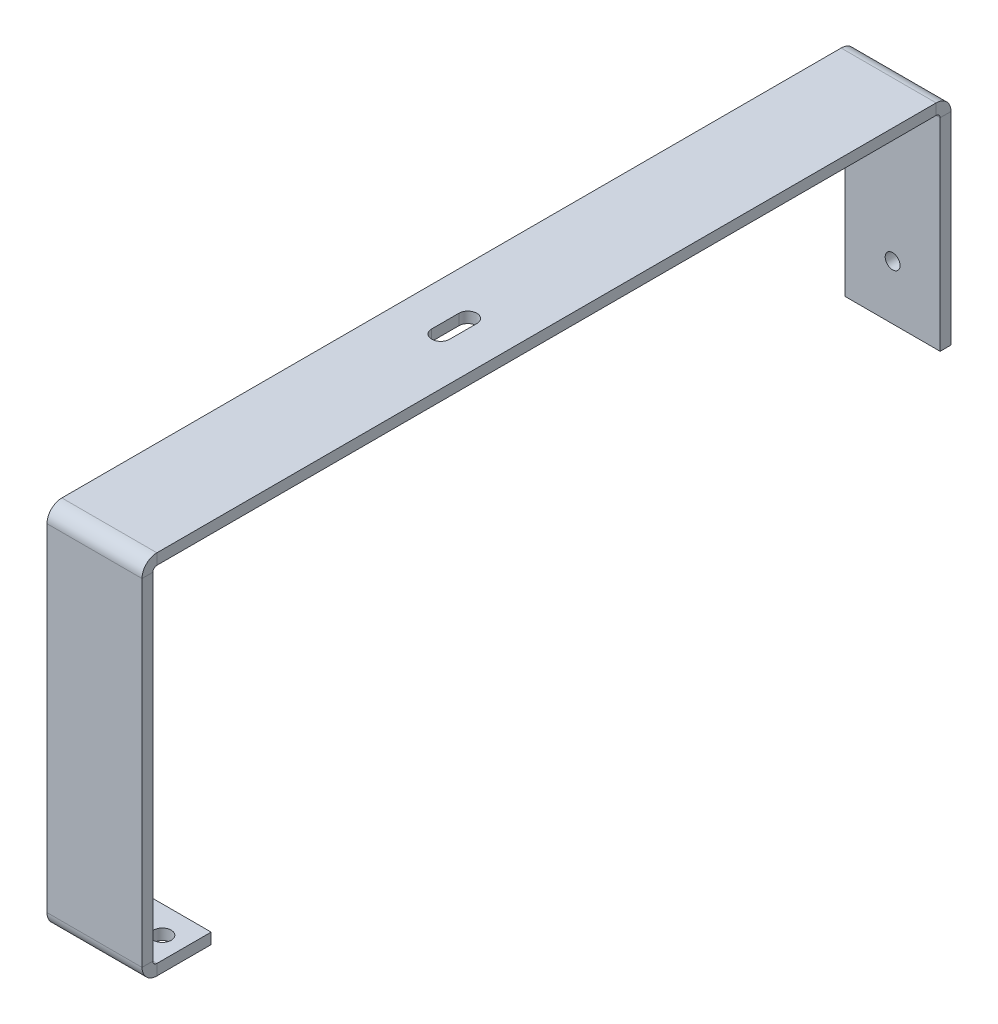
from build123d import *

# Parameters (mm, degrees)
SKETCH1_W                    = 17.5
SKETCH1_H                    = 10
BASE_FLANGE1_DEPTH           = 2
EDGE_FLANGE1_DEPTH           = 17.5
EDGE_FLANGE2_STRIP_W         = 9.4732
EDGE_FLANGE2_STRIP_H         = 2
EDGE_FLANGE2_STRIP_CUT_DEPTH = 17.5
EDGE_FLANGE2_DEPTH           = 17.5
EDGE_FLANGE3_STRIP_W         = 9.4732
EDGE_FLANGE3_STRIP_H         = 2
EDGE_FLANGE3_STRIP_CUT_DEPTH = 17.5
EDGE_FLANGE3_DEPTH           = 17.5
F_4_CLEARANCE_HOLE1_D        = 3.2639
F_4_CLEARANCE_HOLE1_DEPTH    = 2
F_4_CLEARANCE_HOLE1_TIP      = 0.980574487
CUT_EXTRUDE3_DEPTH           = 2
SKETCH25_R                   = 1.373100621
CUT_EXTRUDE4_DEPTH           = 2


# Sheet-metal steps are written as plain solids
with BuildPart() as part:
    # Sketch1 → Base-Flange1 (new body)
    with BuildSketch(Plane(origin=(0, 0, 0), x_dir=(1, 0, 0), z_dir=(0, 1, 0))):
        Rectangle(SKETCH1_W, SKETCH1_H)
    extrude(amount=BASE_FLANGE1_DEPTH)

    # Edge-Flange1 section (across the edge) → Edge-Flange1 (add)
    with BuildSketch(Plane(origin=(-8.75, 2, 5.7366), x_dir=(0, 0, -1), z_dir=(1, 0, 0))):
        with BuildLine():
            Line((-2, 0.7366), (-2, 65.5))
            Line((-2, 65.5), (0, 65.5))
            Line((0, 65.5), (0, 0.7366))
            ThreePointArc((0, 0.7366), (0.215745145, 0.215745145), (0.7366, 0))
            Line((0.7366, 0), (0.7366, -2))
            ThreePointArc((0.7366, -2), (-1.198468417, -1.198468417), (-2, 0.7366))
        make_face()
    extrude(amount=EDGE_FLANGE1_DEPTH)

    # Edge-Flange2 strip (across the edge) → Edge-Flange2 strip cut (cut)
    with BuildSketch(Plane(origin=(-8.75, 67.5, 5.7366), x_dir=(0, -1, 0), z_dir=(1, 0, 0))):
        with Locations((-2, -1)):
            Rectangle(EDGE_FLANGE2_STRIP_W, EDGE_FLANGE2_STRIP_H)
    extrude(amount=EDGE_FLANGE2_STRIP_CUT_DEPTH, mode=Mode.SUBTRACT)

    # Edge-Flange2 section (across the edge) → Edge-Flange2 (add)
    with BuildSketch(Plane(origin=(-8.75, 67.5, 5.7366), x_dir=(0, -1, 0), z_dir=(1, 0, 0))):
        with BuildLine():
            Line((0, 0.7366), (0, 147))
            Line((0, 147), (2, 147))
            Line((2, 147), (2, 0.7366))
            ThreePointArc((2, 0.7366), (2.215745145, 0.215745145), (2.7366, 0))
            Line((2.7366, 0), (2.7366, -2))
            ThreePointArc((2.7366, -2), (0.801531583, -1.198468417), (0, 0.7366))
        make_face()
    extrude(amount=EDGE_FLANGE2_DEPTH)

    # Edge-Flange3 strip (across the edge) → Edge-Flange3 strip cut (cut)
    with BuildSketch(Plane(origin=(-8.75, 65.5, -141.2634), x_dir=(0, 0, 1), z_dir=(1, 0, 0))):
        with Locations((-2, -1)):
            Rectangle(EDGE_FLANGE3_STRIP_W, EDGE_FLANGE3_STRIP_H)
    extrude(amount=EDGE_FLANGE3_STRIP_CUT_DEPTH, mode=Mode.SUBTRACT)

    # Edge-Flange3 section (across the edge) → Edge-Flange3 (add)
    with BuildSketch(Plane(origin=(-8.75, 65.5, -141.2634), x_dir=(0, 0, 1), z_dir=(1, 0, 0))):
        with BuildLine():
            Line((0, 0.7366), (0, 38))
            Line((0, 38), (2, 38))
            Line((2, 38), (2, 0.7366))
            ThreePointArc((2, 0.7366), (2.215745145, 0.215745145), (2.7366, 0))
            Line((2.7366, 0), (2.7366, -2))
            ThreePointArc((2.7366, -2), (0.801531583, -1.198468417), (0, 0.7366))
        make_face()
    extrude(amount=EDGE_FLANGE3_DEPTH)

    # #4 Clearance Hole1
    with Locations(Plane.XZ):
        with Locations((4.75, 0), (-4.75, 0)):
            Hole(F_4_CLEARANCE_HOLE1_D / 2, depth=F_4_CLEARANCE_HOLE1_DEPTH)
            with Locations((0, 0, -(F_4_CLEARANCE_HOLE1_DEPTH + F_4_CLEARANCE_HOLE1_TIP / 2))):  # 118° drill point
                Cone(0, F_4_CLEARANCE_HOLE1_D / 2, F_4_CLEARANCE_HOLE1_TIP, mode=Mode.SUBTRACT)

    # Sketch23 → Cut-Extrude3 (cut)
    with BuildSketch(Plane.XZ.offset(-65.5)):
        with BuildLine():
            Line((-1.65, -61.0268), (-1.65, -56.0268))
            ThreePointArc((-1.65, -56.0268), (0, -54.3768), (1.65, -56.0268))
            Line((1.65, -56.0268), (1.65, -61.0268))
            ThreePointArc((1.65, -61.0268), (0, -62.6768), (-1.65, -61.0268))
        make_face()
    extrude(amount=-CUT_EXTRUDE3_DEPTH, mode=Mode.SUBTRACT)

    # Sketch25 → Cut-Extrude4 (cut)
    with BuildSketch(Plane(origin=(0, 0, -141.2634), x_dir=(-1, 0, 0), z_dir=(0, 0, -1))):
        with Locations(Location((0, 37.5, 0), (0, 0, 90))):
            Circle(SKETCH25_R)
    extrude(amount=-CUT_EXTRUDE4_DEPTH, mode=Mode.SUBTRACT)


solid = part.part
